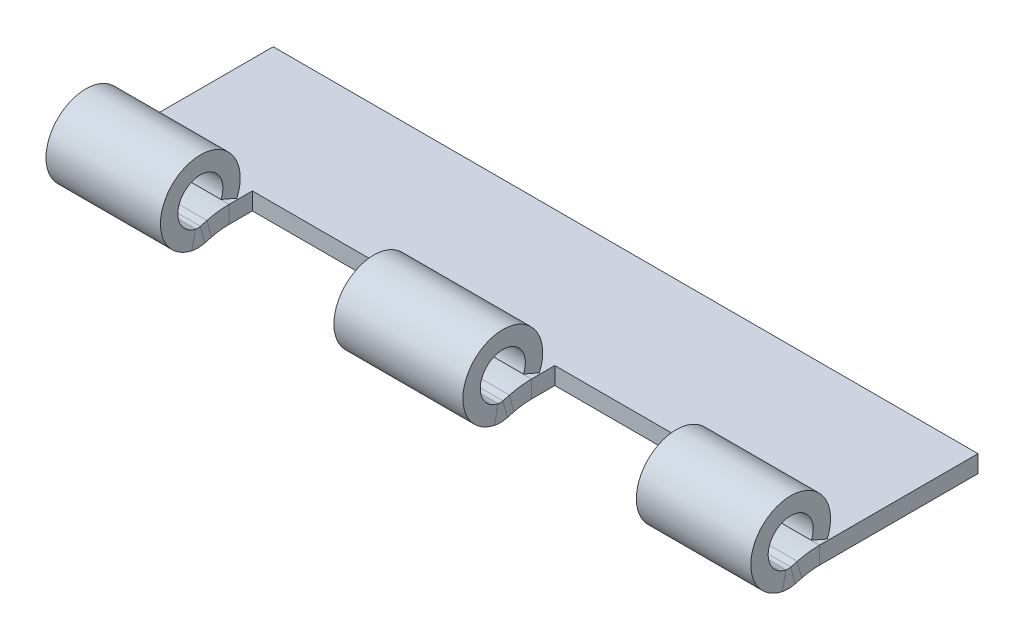
from build123d import *

# Parameters (mm, degrees)
BASE_FLANGE1_DEPTH      = 50.8
CUT_EXTRUDE1_DEPTH      = 58.816109347
CUT_EXTRUDE1_DEPTH_BACK = 58.816109347
SKETCH6_W               = 25
SKETCH6_H               = 58.775055245


# Sheet-metal steps are written as plain solids
with BuildPart() as part:
    # Sketch1 → Base-Flange1 (new, symmetric)
    with BuildSketch(Plane(origin=(0, 0, 0), x_dir=(0, 0, -1), z_dir=(1, 0, 0))):
        with BuildLine():
            Line((27, -5), (4.137865616, -5))
            ThreePointArc((4.137865616, -5), (2.850262482, -5.083242558), (1.584096024, -5.331584366))
            Line((1.584096024, -5.331584366), (0.651734752, -5.577853864))
            ThreePointArc((0.651734752, -5.577853864), (-0.279113067, -5.709460074), (-1.214968707, -5.620173577))
            ThreePointArc((-1.214968707, -5.620173577), (-2.620425709, 5.118190022), (5.269962049, -2.3))
            Line((5.269962049, -2.3), (2.978674202, -1.3))
            ThreePointArc((2.978674202, -1.3), (-1.481110183, 2.892890013), (-0.686721443, -3.176619848))
            ThreePointArc((-0.686721443, -3.176619848), (-0.335775578, -3.210102284), (0.013292354, -3.160749956))
            Line((0.013292354, -3.160749956), (0.945653625, -2.914480458))
            ThreePointArc((0.945653625, -2.914480458), (2.528361698, -2.604053197), (4.137865616, -2.5))
            Line((4.137865616, -2.5), (27, -2.5))
            Line((27, -2.5), (27, -5))
        make_face()
    extrude(amount=BASE_FLANGE1_DEPTH, both=True)

    # Sketch6 → Cut-Extrude1 (cut, two sides: drawn at the far end of the back side and taken through both)
    with BuildSketch(Plane(origin=(0, 0, 0), x_dir=(1, 0, 0), z_dir=(0, 1, 0)).offset(-CUT_EXTRUDE1_DEPTH_BACK)):
        with Locations((-21.8, -21.887527623)):
            Rectangle(SKETCH6_W, SKETCH6_H)
        with Locations((21.8, -21.887527623)):
            Rectangle(SKETCH6_W, SKETCH6_H)
    extrude(amount=CUT_EXTRUDE1_DEPTH + CUT_EXTRUDE1_DEPTH_BACK, mode=Mode.SUBTRACT)


solid = part.part
